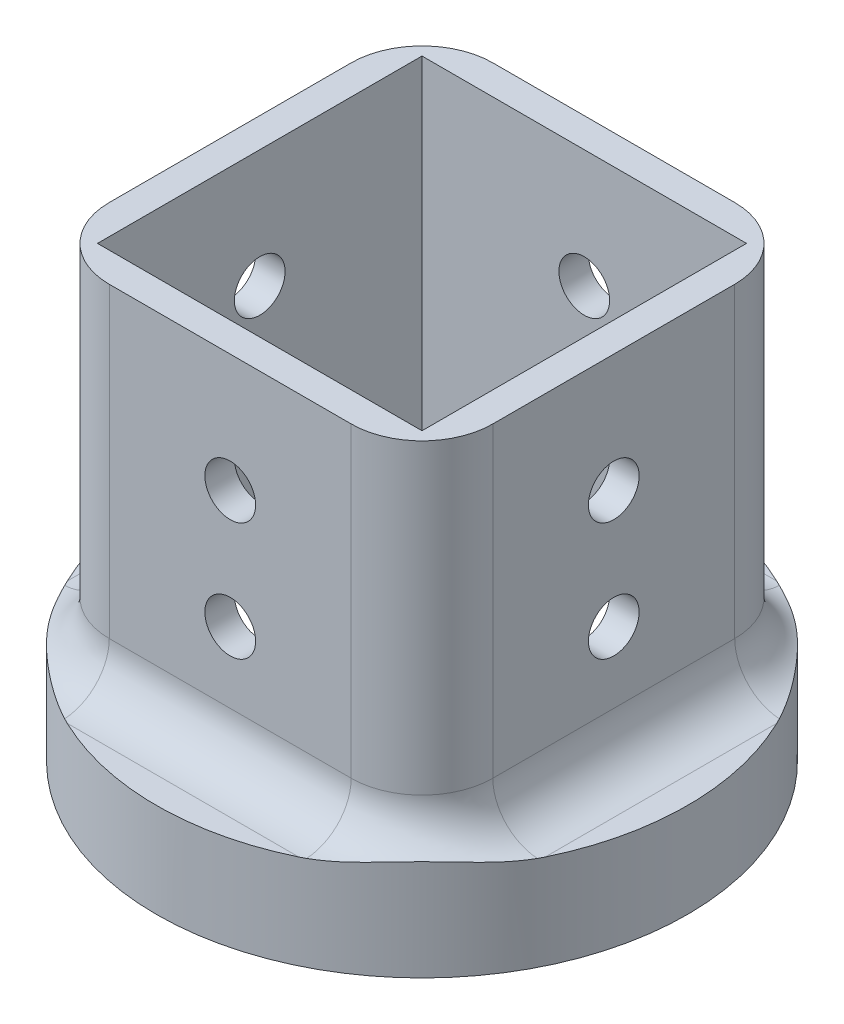
from build123d import *

# Parameters (mm, degrees)
SKETCH_1_R          = 22.5
SKETCH_1_R_2        = 20.5
EXTRUDE_1_DEPTH     = 6
SKETCH_2_R          = 22.5
EXTRUDE_2_DEPTH     = 2
SKETCH_3_W          = 26.5
SKETCH_3_H          = 26.5
SKETCH_3_W_2        = 20.5
SKETCH_3_H_2        = 20.5
EXTRUDE_3_DEPTH     = 30
SKETCH_4_R          = 2.15
CUT_EXTRUDE_1_DEPTH = 30
SKETCH_5_R          = 2.15
CUT_EXTRUDE_2_DEPTH = 30
FILLET_1_R          = 3
SKETCH_7_W          = 26.5
SKETCH_7_H          = 26.5
EXTRUDE_4_DEPTH     = 30
SKETCH_8_W          = 27.5
SKETCH_8_H          = 27.5
CUT_EXTRUDE_4_DEPTH = 50.563091106
FILLET_2_R          = 4
SKETCH_9_R          = 2.15
CUT_EXTRUDE_5_DEPTH = 59.752127725
SKETCH_10_R         = 2.15
CUT_EXTRUDE_6_DEPTH = 59.752127725


with BuildPart() as part:
    # 草图1 → 凸台-拉伸1 (new body)
    with BuildSketch(Plane(origin=(0, 0, 0), x_dir=(1, 0, 0), z_dir=(0, 1, 0))):
        with Locations(Location((0, 0, 0), (0, 0, 270))):
            Circle(SKETCH_1_R)
        with Locations(Location((0, 0, 0), (0, 0, 270))):
            Circle(SKETCH_1_R_2, mode=Mode.SUBTRACT)
    extrude(amount=EXTRUDE_1_DEPTH)

    # 草图2 → 凸台-拉伸2 (add)
    with BuildSketch(Plane(origin=(0, 6, 0), x_dir=(1, 0, 0), z_dir=(0, 1, 0))):
        with Locations(Location((0, 0, 0), (0, 0, 270))):
            Circle(SKETCH_2_R)
    extrude(amount=EXTRUDE_2_DEPTH)

    # 草图3 → 凸台-拉伸3 (add)
    with BuildSketch(Plane(origin=(0, 8, 0), x_dir=(1, 0, 0), z_dir=(0, 1, 0))):
        Rectangle(SKETCH_3_W, SKETCH_3_H)
        Rectangle(SKETCH_3_W_2, SKETCH_3_H_2, mode=Mode.SUBTRACT)
    extrude(amount=EXTRUDE_3_DEPTH)

    # 草图4 → 切除-拉伸1 (cut)
    with BuildSketch(Plane.XY.offset(13.25)):
        with Locations((0, 28)):
            Circle(SKETCH_4_R)
        with Locations((0, 18)):
            Circle(SKETCH_4_R)
    extrude(amount=-CUT_EXTRUDE_1_DEPTH, mode=Mode.SUBTRACT)

    # 草图5 → 切除-拉伸2 (cut)
    with BuildSketch(Plane(origin=(13.25, 0, 0), x_dir=(0, 0, -1), z_dir=(1, 0, 0))):
        with Locations((0, 28)):
            Circle(SKETCH_5_R)
        with Locations((0, 18)):
            Circle(SKETCH_5_R)
    extrude(amount=-CUT_EXTRUDE_2_DEPTH, mode=Mode.SUBTRACT)

    # 圆角1
    fillet_1_edges = [part.edges().sort_by_distance(p)[0] for p in [
        (-13.25, 23, -13.25),
        (-13.25, 23, 13.25),
        (13.25, 23, 13.25),
        (13.25, 23, -13.25),
    ]]
    fillet(fillet_1_edges, radius=FILLET_1_R)

    # 草图7 → 凸台-拉伸4 (add)
    with BuildSketch(Plane(origin=(0, 38, 0), x_dir=(1, 0, 0), z_dir=(0, 1, 0))):
        with BuildLine():
            Line((-16.25, 10.25), (-16.25, -10.25))
            ThreePointArc((-16.25, -10.25), (-14.492640687, -14.492640687), (-10.25, -16.25))
            Line((-10.25, -16.25), (10.25, -16.25))
            ThreePointArc((10.25, -16.25), (14.492640687, -14.492640687), (16.25, -10.25))
            Line((16.25, -10.25), (16.25, 10.25))
            ThreePointArc((16.25, 10.25), (14.492640687, 14.492640687), (10.25, 16.25))
            Line((10.25, 16.25), (-10.25, 16.25))
            ThreePointArc((-10.25, 16.25), (-14.492640687, 14.492640687), (-16.25, 10.25))
        make_face()
        Rectangle(SKETCH_7_W, SKETCH_7_H, mode=Mode.SUBTRACT)
    extrude(amount=-EXTRUDE_4_DEPTH)

    # 草图8 → 切除-拉伸4 (cut, through all)
    with BuildSketch(Plane(origin=(0, 38, 0), x_dir=(1, 0, 0), z_dir=(0, 1, 0))):
        Rectangle(SKETCH_8_W, SKETCH_8_H)
    extrude(amount=-CUT_EXTRUDE_4_DEPTH, mode=Mode.SUBTRACT)

    # 圆角2
    # the kernel refuses this fillet: 4 mm, written as the material it adds along each edge
    with BuildSketch(Plane(origin=(-10.25, 8, -10.25), x_dir=(0, 0, -1), z_dir=(1, 0, 0))) as fillet_2_piece_1_section:
        with BuildLine():
            CenterArc((6 + FILLET_2_R, FILLET_2_R), FILLET_2_R, 180, 90)
            Line((6, FILLET_2_R), (6, 0))
            Line((6, 0), (6 + FILLET_2_R, 0))
        make_face()
    fillet_2_piece_1 = revolve(axis=Axis((-10.25, 8, -10.25), (0, 1, 0)), revolution_arc=90, mode=Mode.PRIVATE)
    fillet_2_piece_1 = fillet_2_piece_1 & Plane(origin=(0, 8.919609383, 0), x_dir=(0, 0, 1), z_dir=(0, -1, 0)) * Cylinder(22.5, 40, mode=Mode.PRIVATE)
    add(fillet_2_piece_1)
    with BuildSketch(Plane(origin=(10.25, 8, -16.25), x_dir=(0, 0, -1), z_dir=(-1, 0, 0))) as fillet_2_piece_2_section:
        with BuildLine():
            CenterArc((FILLET_2_R, -FILLET_2_R), FILLET_2_R, 90, 90)
            Line((0, -FILLET_2_R), (0, 0))
            Line((0, 0), (FILLET_2_R, 0))
        make_face()
    fillet_2_piece_2 = extrude(amount=20.5, mode=Mode.PRIVATE)
    fillet_2_piece_2 = fillet_2_piece_2 & Plane(origin=(0, 8.90566888, 0), x_dir=(0, 0, 1), z_dir=(0, -1, 0)) * Cylinder(22.5, 57, mode=Mode.PRIVATE)
    add(fillet_2_piece_2)
    with BuildSketch(Plane(origin=(10.25, 8, -10.25), x_dir=(1, 0, 0), z_dir=(0, 0, 1))) as fillet_2_piece_3_section:
        with BuildLine():
            CenterArc((6 + FILLET_2_R, FILLET_2_R), FILLET_2_R, 180, 90)
            Line((6, FILLET_2_R), (6, 0))
            Line((6, 0), (6 + FILLET_2_R, 0))
        make_face()
    fillet_2_piece_3 = revolve(axis=Axis((10.25, 8, -10.25), (0, 1, 0)), revolution_arc=90, mode=Mode.PRIVATE)
    fillet_2_piece_3 = fillet_2_piece_3 & Plane(origin=(0, 8.919609383, 0), x_dir=(0, 0, 1), z_dir=(0, -1, 0)) * Cylinder(22.5, 40, mode=Mode.PRIVATE)
    add(fillet_2_piece_3)
    with BuildSketch(Plane(origin=(16.25, 8, 10.25), x_dir=(1, 0, 0), z_dir=(0, 0, -1))) as fillet_2_piece_4_section:
        with BuildLine():
            CenterArc((FILLET_2_R, -FILLET_2_R), FILLET_2_R, 90, 90)
            Line((0, -FILLET_2_R), (0, 0))
            Line((0, 0), (FILLET_2_R, 0))
        make_face()
    fillet_2_piece_4 = extrude(amount=20.5, mode=Mode.PRIVATE)
    fillet_2_piece_4 = fillet_2_piece_4 & Plane(origin=(0, 8.90566888, 0), x_dir=(0, 0, 1), z_dir=(0, -1, 0)) * Cylinder(22.5, 57, mode=Mode.PRIVATE)
    add(fillet_2_piece_4)
    with BuildSketch(Plane(origin=(10.25, 8, 10.25), x_dir=(0, 0, 1), z_dir=(-1, 0, 0))) as fillet_2_piece_5_section:
        with BuildLine():
            CenterArc((6 + FILLET_2_R, FILLET_2_R), FILLET_2_R, 180, 90)
            Line((6, FILLET_2_R), (6, 0))
            Line((6, 0), (6 + FILLET_2_R, 0))
        make_face()
    fillet_2_piece_5 = revolve(axis=Axis((10.25, 8, 10.25), (0, 1, 0)), revolution_arc=90, mode=Mode.PRIVATE)
    fillet_2_piece_5 = fillet_2_piece_5 & Plane(origin=(0, 8.919609383, 0), x_dir=(0, 0, 1), z_dir=(0, -1, 0)) * Cylinder(22.5, 40, mode=Mode.PRIVATE)
    add(fillet_2_piece_5)
    with BuildSketch(Plane(origin=(-10.25, 8, 16.25), x_dir=(0, 0, 1), z_dir=(1, 0, 0))) as fillet_2_piece_6_section:
        with BuildLine():
            CenterArc((FILLET_2_R, -FILLET_2_R), FILLET_2_R, 90, 90)
            Line((0, -FILLET_2_R), (0, 0))
            Line((0, 0), (FILLET_2_R, 0))
        make_face()
    fillet_2_piece_6 = extrude(amount=20.5, mode=Mode.PRIVATE)
    fillet_2_piece_6 = fillet_2_piece_6 & Plane(origin=(0, 8.90566888, 0), x_dir=(0, 0, 1), z_dir=(0, -1, 0)) * Cylinder(22.5, 57, mode=Mode.PRIVATE)
    add(fillet_2_piece_6)
    with BuildSketch(Plane(origin=(-10.25, 8, 10.25), x_dir=(-1, 0, 0), z_dir=(0, 0, -1))) as fillet_2_piece_7_section:
        with BuildLine():
            CenterArc((6 + FILLET_2_R, FILLET_2_R), FILLET_2_R, 180, 90)
            Line((6, FILLET_2_R), (6, 0))
            Line((6, 0), (6 + FILLET_2_R, 0))
        make_face()
    fillet_2_piece_7 = revolve(axis=Axis((-10.25, 8, 10.25), (0, 1, 0)), revolution_arc=90, mode=Mode.PRIVATE)
    fillet_2_piece_7 = fillet_2_piece_7 & Plane(origin=(0, 8.919609383, 0), x_dir=(0, 0, 1), z_dir=(0, -1, 0)) * Cylinder(22.5, 40, mode=Mode.PRIVATE)
    add(fillet_2_piece_7)
    with BuildSketch(Plane(origin=(-16.25, 8, -10.25), x_dir=(-1, 0, 0), z_dir=(0, 0, 1))) as fillet_2_piece_8_section:
        with BuildLine():
            CenterArc((FILLET_2_R, -FILLET_2_R), FILLET_2_R, 90, 90)
            Line((0, -FILLET_2_R), (0, 0))
            Line((0, 0), (FILLET_2_R, 0))
        make_face()
    fillet_2_piece_8 = extrude(amount=20.5, mode=Mode.PRIVATE)
    fillet_2_piece_8 = fillet_2_piece_8 & Plane(origin=(0, 8.90566888, 0), x_dir=(0, 0, 1), z_dir=(0, -1, 0)) * Cylinder(22.5, 57, mode=Mode.PRIVATE)
    add(fillet_2_piece_8)

    # 草图9 → 切除-拉伸5 (cut, through all)
    with BuildSketch(Plane(origin=(16.25, 0, 0), x_dir=(0, 0, -1), z_dir=(1, 0, 0))):
        with Locations((0, 28)):
            Circle(SKETCH_9_R)
        with Locations((0, 18)):
            Circle(SKETCH_9_R)
    extrude(amount=-CUT_EXTRUDE_5_DEPTH, mode=Mode.SUBTRACT)

    # 草图10 → 切除-拉伸6 (cut, through all)
    with BuildSketch(Plane.XY.offset(16.25)):
        with Locations((0, 28)):
            Circle(SKETCH_10_R)
        with Locations((0, 18)):
            Circle(SKETCH_10_R)
    extrude(amount=-CUT_EXTRUDE_6_DEPTH, mode=Mode.SUBTRACT)


solid = part.part
